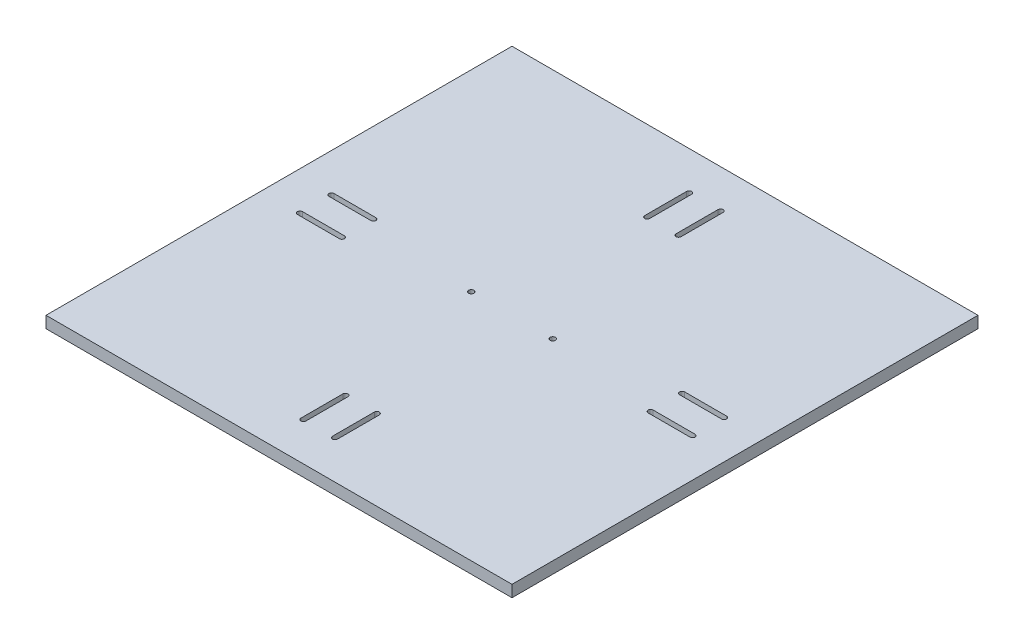
from build123d import *

# Parameters (mm, degrees)
ESBO_O1_W                = 400
ESBO_O1_H                = 400
RESSALTO_EXTRUS_O1_DEPTH = 10
ESBO_O3_R                = 2.25
CORTE_EXTRUS_O3_DEPTH    = 566.773806393
CUT_EXTRUDE1_DEPTH       = 566.773806393


with BuildPart() as part:
    # Esboço1 → Ressalto-extrusão1 (new body)
    with BuildSketch(Plane(origin=(0, 0, 0), x_dir=(1, 0, 0), z_dir=(0, 1, 0))):
        with Locations((200, 200)):
            Rectangle(ESBO_O1_W, ESBO_O1_H)
    extrude(amount=RESSALTO_EXTRUS_O1_DEPTH)

    # Esboço3 → Corte-extrusão3 (cut, through all)
    with BuildSketch(Plane(origin=(0, 10, 0), x_dir=(1, 0, 0), z_dir=(0, 1, 0))):
        with Locations((165, 200)):
            Circle(ESBO_O3_R)
        with Locations((235, 200)):
            Circle(ESBO_O3_R)
    extrude(amount=-CORTE_EXTRUS_O3_DEPTH, mode=Mode.SUBTRACT)

    # Esboço2 → Cut-Extrude1 (cut, through all)
    with BuildSketch(Plane(origin=(0, 10, 0), x_dir=(1, 0, 0), z_dir=(0, 1, 0))):
        with BuildLine():
            Line((182.85, 367), (182.85, 331))
            ThreePointArc((182.85, 331), (185, 328.85), (187.15, 331))
            Line((187.15, 331), (187.15, 367))
            ThreePointArc((187.15, 367), (185, 369.15), (182.85, 367))
        make_face()
        with BuildLine():
            Line((209.85, 367), (209.85, 331))
            ThreePointArc((209.85, 331), (212, 328.85), (214.15, 331))
            Line((214.15, 331), (214.15, 367))
            ThreePointArc((214.15, 367), (212, 369.15), (209.85, 367))
        make_face()
        with BuildLine():
            Line((367, 185.85), (331, 185.85))
            ThreePointArc((331, 185.85), (328.85, 188), (331, 190.15))
            Line((331, 190.15), (367, 190.15))
            ThreePointArc((367, 190.15), (369.15, 188), (367, 185.85))
        make_face()
        with BuildLine():
            Line((367, 212.85), (331, 212.85))
            ThreePointArc((331, 212.85), (328.85, 215), (331, 217.15))
            Line((331, 217.15), (367, 217.15))
            ThreePointArc((367, 217.15), (369.15, 215), (367, 212.85))
        make_face()
        with BuildLine():
            Line((185.85, 33), (185.85, 69))
            ThreePointArc((185.85, 69), (188, 71.15), (190.15, 69))
            Line((190.15, 69), (190.15, 33))
            ThreePointArc((190.15, 33), (188, 30.85), (185.85, 33))
        make_face()
        with BuildLine():
            Line((212.85, 33), (212.85, 69))
            ThreePointArc((212.85, 69), (215, 71.15), (217.15, 69))
            Line((217.15, 69), (217.15, 33))
            ThreePointArc((217.15, 33), (215, 30.85), (212.85, 33))
        make_face()
        with BuildLine():
            Line((33, 214.15), (69, 214.15))
            ThreePointArc((69, 214.15), (71.15, 212), (69, 209.85))
            Line((69, 209.85), (33, 209.85))
            ThreePointArc((33, 209.85), (30.85, 212), (33, 214.15))
        make_face()
        with BuildLine():
            Line((33, 187.15), (69, 187.15))
            ThreePointArc((69, 187.15), (71.15, 185), (69, 182.85))
            Line((69, 182.85), (33, 182.85))
            ThreePointArc((33, 182.85), (30.85, 185), (33, 187.15))
        make_face()
    extrude(amount=-CUT_EXTRUDE1_DEPTH, mode=Mode.SUBTRACT)


solid = part.part
